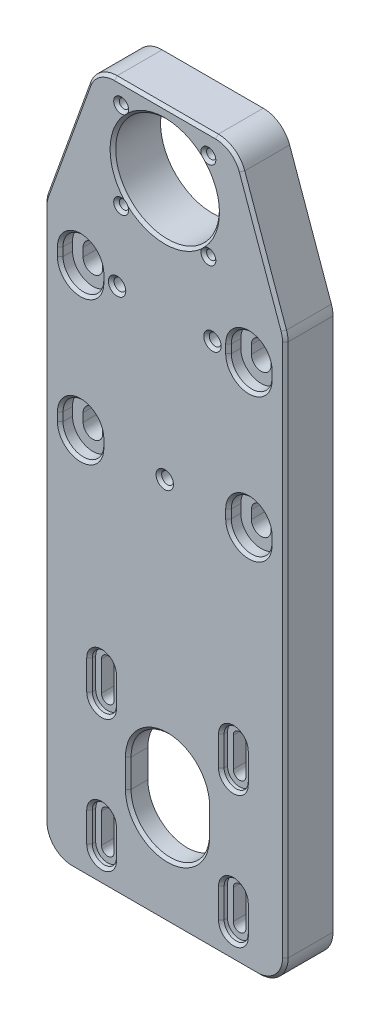
from build123d import *

# Parameters (mm, degrees)
SKETCH1_R                                = 18.5
SKETCH1_W                                = 86
SKETCH1_H                                = 77
SKETCH1_H_2                              = 125
BOSS_EXTRUDE1_DEPTH                      = 17
M4X0_7_TAPPED_HOLE1_D                    = 3.3
M4X0_7_TAPPED_HOLE1_DEPTH                = 20
M4X0_7_TAPPED_HOLE1_TIP                  = 0.991420021
CBORE_SLOT_FOR_M4_SBHCS3_DEPTH           = 17
CBORE_START                              = 14.8
CBORE_SLOT_FOR_M4_SBHCS3_2_DEPTH         = 2.2
CUT_EXTRUDE1_DEPTH                       = 138.03649149
CBORE_SLOT_FOR_M6_HEX_HEAD_BOLT1_DEPTH   = 17
CBORE_START_2                            = 12.62
CBORE_SLOT_FOR_M6_HEX_HEAD_BOLT1_2_DEPTH = 4.38
FILLET1_R                                = 10
CUT_EXTRUDE2_DEPTH                       = 10
SKETCH22_R                               = 2.1
CUT_EXTRUDE3_DEPTH                       = 138.03649149
CHAMFER1_SIZE                            = 1


# Read off the part's stored shape, not the designer's step: CBORE SLOT for M4 SBHCS3, CBORE SLOT for M6 Hex Head Bolt1
with BuildPart() as part:
    # Sketch1 → Boss-Extrude1 (new body)
    # profile 1 of 3: a face of its own
    with BuildSketch(Plane.XY):
        Polygon((14.773286703, 129), (-14.773286703, 129), (-24.97132573, 129), (-43, 79), (43, 79), (25.15845151, 129), (20.15845151, 129), align=None)
        with Locations((0, 106)):
            Circle(SKETCH1_R, mode=Mode.SUBTRACT)
    # profile 2 of 3: a face of its own
    with BuildSketch(Plane.XY):
        with Locations((0, 40.5)):
            Rectangle(SKETCH1_W, SKETCH1_H)
    # profile 3 of 3: a face of its own
    with BuildSketch(Plane.XY):
        with Locations((0, -60.5)):
            Rectangle(SKETCH1_W, SKETCH1_H_2)
    extrude(amount=BOSS_EXTRUDE1_DEPTH)

    # M4x0.7 Tapped Hole1
    with Locations(Plane(origin=(-15.556349182, 90.443650818, 17), x_dir=(1, 0, 0), z_dir=(0, 0, 1))):
        with Locations((0, 0), (0, 31.112698364), (31.112698364, 31.112698364), (31.112698364, 0)):
            Hole(M4X0_7_TAPPED_HOLE1_D / 2, depth=M4X0_7_TAPPED_HOLE1_DEPTH)
            with Locations((0, 0, -(M4X0_7_TAPPED_HOLE1_DEPTH + M4X0_7_TAPPED_HOLE1_TIP / 2))):  # 118° drill point
                Cone(0, M4X0_7_TAPPED_HOLE1_D / 2, M4X0_7_TAPPED_HOLE1_TIP, mode=Mode.SUBTRACT)

    # CBORE SLOT for M4 SBHCS3 outline → CBORE SLOT for M4 SBHCS3 (cut)
    with BuildSketch(Plane.XY):
        with BuildLine():
            ThreePointArc((-20.274967442, -102.200025), (-22.524967442, -99.950025), (-24.774967442, -102.200025))
            Line((-24.774967442, -102.200025), (-24.774967442, -112.700025))
            ThreePointArc((-24.774967442, -112.700025), (-22.524967442, -114.950025), (-20.274967442, -112.700025))
            Line((-20.274967442, -112.700025), (-20.274967442, -102.200025))
        make_face()
        with BuildLine():
            ThreePointArc((-20.274967442, -55.200025), (-22.524967442, -52.950025), (-24.774967442, -55.200025))
            Line((-24.774967442, -55.200025), (-24.774967442, -65.700025))
            ThreePointArc((-24.774967442, -65.700025), (-22.524967442, -67.950025), (-20.274967442, -65.700025))
            Line((-20.274967442, -65.700025), (-20.274967442, -55.200025))
        make_face()
        with BuildLine():
            Line((26.725032558, -112.700025), (26.725032558, -102.200025))
            ThreePointArc((26.725032558, -102.200025), (24.475032558, -99.950025), (22.225032558, -102.200025))
            Line((22.225032558, -102.200025), (22.225032558, -112.700025))
            ThreePointArc((22.225032558, -112.700025), (24.475032558, -114.950025), (26.725032558, -112.700025))
        make_face()
        with BuildLine():
            ThreePointArc((22.225032558, -65.700025), (24.475032558, -67.950025), (26.725032558, -65.700025))
            Line((26.725032558, -65.700025), (26.725032558, -55.200025))
            ThreePointArc((26.725032558, -55.200025), (24.475032558, -52.950025), (22.225032558, -55.200025))
            Line((22.225032558, -55.200025), (22.225032558, -65.700025))
        make_face()
    extrude(amount=CBORE_SLOT_FOR_M4_SBHCS3_DEPTH, mode=Mode.SUBTRACT)

    # CBORE SLOT for M4 SBHCS3 2 outline → CBORE SLOT for M4 SBHCS3 2 (cut)
    # profile 1 of 4: a face of its own
    with BuildSketch(Plane.XY.offset(CBORE_START)):
        with BuildLine():
            Line((-18.224967442, -112.700025), (-18.224967442, -102.200025))
            ThreePointArc((-18.224967442, -102.200025), (-22.524967442, -97.900025), (-26.824967442, -102.200025))
            Line((-26.824967442, -102.200025), (-26.824967442, -112.700025))
            ThreePointArc((-26.824967442, -112.700025), (-22.524967442, -117.000025), (-18.224967442, -112.700025))
        make_face()
        with BuildLine():
            Line((-24.774967442, -112.700025), (-24.774967442, -102.200025))
            ThreePointArc((-24.774967442, -102.200025), (-22.524967442, -99.950025), (-20.274967442, -102.200025))
            Line((-20.274967442, -102.200025), (-20.274967442, -112.700025))
            ThreePointArc((-20.274967442, -112.700025), (-22.524967442, -114.950025), (-24.774967442, -112.700025))
        make_face(mode=Mode.SUBTRACT)
    # profile 2 of 4: a face of its own
    with BuildSketch(Plane.XY.offset(CBORE_START)):
        with BuildLine():
            ThreePointArc((-18.224967442, -55.200025), (-22.524967442, -50.900025), (-26.824967442, -55.200025))
            Line((-26.824967442, -55.200025), (-26.824967442, -65.700025))
            ThreePointArc((-26.824967442, -65.700025), (-22.524967442, -70.000025), (-18.224967442, -65.700025))
            Line((-18.224967442, -65.700025), (-18.224967442, -55.200025))
        make_face()
        with BuildLine():
            Line((-24.774967442, -65.700025), (-24.774967442, -55.200025))
            ThreePointArc((-24.774967442, -55.200025), (-22.524967442, -52.950025), (-20.274967442, -55.200025))
            Line((-20.274967442, -55.200025), (-20.274967442, -65.700025))
            ThreePointArc((-20.274967442, -65.700025), (-22.524967442, -67.950025), (-24.774967442, -65.700025))
        make_face(mode=Mode.SUBTRACT)
    # profile 3 of 4: a face of its own
    with BuildSketch(Plane.XY.offset(CBORE_START)):
        with BuildLine():
            Line((28.775032558, -112.700025), (28.775032558, -102.200025))
            ThreePointArc((28.775032558, -102.200025), (24.475032558, -97.900025), (20.175032558, -102.200025))
            Line((20.175032558, -102.200025), (20.175032558, -112.700025))
            ThreePointArc((20.175032558, -112.700025), (24.475032558, -117.000025), (28.775032558, -112.700025))
        make_face()
        with BuildLine():
            ThreePointArc((22.225032558, -102.200025), (24.475032558, -99.950025), (26.725032558, -102.200025))
            Line((26.725032558, -102.200025), (26.725032558, -112.700025))
            ThreePointArc((26.725032558, -112.700025), (24.475032558, -114.950025), (22.225032558, -112.700025))
            Line((22.225032558, -112.700025), (22.225032558, -102.200025))
        make_face(mode=Mode.SUBTRACT)
    # profile 4 of 4: a face of its own
    with BuildSketch(Plane.XY.offset(CBORE_START)):
        with BuildLine():
            ThreePointArc((28.775032558, -55.200025), (24.475032558, -50.900025), (20.175032558, -55.200025))
            Line((20.175032558, -55.200025), (20.175032558, -65.700025))
            ThreePointArc((20.175032558, -65.700025), (24.475032558, -70.000025), (28.775032558, -65.700025))
            Line((28.775032558, -65.700025), (28.775032558, -55.200025))
        make_face()
        with BuildLine():
            Line((26.725032558, -55.200025), (26.725032558, -65.700025))
            ThreePointArc((26.725032558, -65.700025), (24.475032558, -67.950025), (22.225032558, -65.700025))
            Line((22.225032558, -65.700025), (22.225032558, -55.200025))
            ThreePointArc((22.225032558, -55.200025), (24.475032558, -52.950025), (26.725032558, -55.200025))
        make_face(mode=Mode.SUBTRACT)
    extrude(amount=CBORE_SLOT_FOR_M4_SBHCS3_2_DEPTH, mode=Mode.SUBTRACT)

    # Sketch13 → Cut-Extrude1 (cut, through all)
    with BuildSketch(Plane.XY.offset(17)):
        with BuildLine():
            Line((14.975032558, -78.950025), (14.975032558, -88.950025))
            ThreePointArc((14.975032558, -88.950025), (0.975032558, -102.950025), (-13.024967442, -88.950025))
            Line((-13.024967442, -88.950025), (-13.024967442, -78.950025))
            ThreePointArc((-13.024967442, -78.950025), (0.975032558, -64.950025), (14.975032558, -78.950025))
        make_face()
    extrude(amount=-CUT_EXTRUDE1_DEPTH, mode=Mode.SUBTRACT)

    # CBORE SLOT for M6 Hex Head Bolt1 outline → CBORE SLOT for M6 Hex Head Bolt1 (cut)
    with BuildSketch(Plane.XY):
        with BuildLine():
            Line((26.5, 15.5), (26.5, 12.5))
            ThreePointArc((26.5, 12.5), (30, 9), (33.5, 12.5))
            Line((33.5, 12.5), (33.5, 15.5))
            ThreePointArc((33.5, 15.5), (30, 19), (26.5, 15.5))
        make_face()
        with BuildLine():
            ThreePointArc((26.5, 63.5), (30, 60), (33.5, 63.5))
            Line((33.5, 63.5), (33.5, 66.5))
            ThreePointArc((33.5, 66.5), (30, 70), (26.5, 66.5))
            Line((26.5, 66.5), (26.5, 63.5))
        make_face()
        with BuildLine():
            ThreePointArc((-33.5, 12.5), (-30, 9), (-26.5, 12.5))
            Line((-26.5, 12.5), (-26.5, 15.5))
            ThreePointArc((-26.5, 15.5), (-30, 19), (-33.5, 15.5))
            Line((-33.5, 15.5), (-33.5, 12.5))
        make_face()
        with BuildLine():
            ThreePointArc((-33.5, 63.5), (-30, 60), (-26.5, 63.5))
            Line((-26.5, 63.5), (-26.5, 66.5))
            ThreePointArc((-26.5, 66.5), (-30, 70), (-33.5, 66.5))
            Line((-33.5, 66.5), (-33.5, 63.5))
        make_face()
    extrude(amount=CBORE_SLOT_FOR_M6_HEX_HEAD_BOLT1_DEPTH, mode=Mode.SUBTRACT)

    # CBORE SLOT for M6 Hex Head Bolt1 2 outli → CBORE SLOT for M6 Hex Head Bolt1 2 (cut)
    # profile 1 of 4: a face of its own
    with BuildSketch(Plane.XY.offset(CBORE_START_2)):
        with BuildLine():
            Line((37.275, 12.5), (37.275, 15.5))
            ThreePointArc((37.275, 15.5), (30, 22.775), (22.725, 15.5))
            Line((22.725, 15.5), (22.725, 12.5))
            ThreePointArc((22.725, 12.5), (30, 5.225), (37.275, 12.5))
        make_face()
        with BuildLine():
            ThreePointArc((33.5, 12.5), (30, 9), (26.5, 12.5))
            Line((26.5, 12.5), (26.5, 15.5))
            ThreePointArc((26.5, 15.5), (30, 19), (33.5, 15.5))
            Line((33.5, 15.5), (33.5, 12.5))
        make_face(mode=Mode.SUBTRACT)
    # profile 2 of 4: a face of its own
    with BuildSketch(Plane.XY.offset(CBORE_START_2)):
        with BuildLine():
            ThreePointArc((37.275, 66.5), (30, 73.775), (22.725, 66.5))
            Line((22.725, 66.5), (22.725, 63.5))
            ThreePointArc((22.725, 63.5), (30, 56.225), (37.275, 63.5))
            Line((37.275, 63.5), (37.275, 66.5))
        make_face()
        with BuildLine():
            Line((33.5, 66.5), (33.5, 63.5))
            ThreePointArc((33.5, 63.5), (30, 60), (26.5, 63.5))
            Line((26.5, 63.5), (26.5, 66.5))
            ThreePointArc((26.5, 66.5), (30, 70), (33.5, 66.5))
        make_face(mode=Mode.SUBTRACT)
    # profile 3 of 4: a face of its own
    with BuildSketch(Plane.XY.offset(CBORE_START_2)):
        with BuildLine():
            Line((-22.725, 12.5), (-22.725, 15.5))
            ThreePointArc((-22.725, 15.5), (-30, 22.775), (-37.275, 15.5))
            Line((-37.275, 15.5), (-37.275, 12.5))
            ThreePointArc((-37.275, 12.5), (-30, 5.225), (-22.725, 12.5))
        make_face()
        with BuildLine():
            Line((-26.5, 15.5), (-26.5, 12.5))
            ThreePointArc((-26.5, 12.5), (-30, 9), (-33.5, 12.5))
            Line((-33.5, 12.5), (-33.5, 15.5))
            ThreePointArc((-33.5, 15.5), (-30, 19), (-26.5, 15.5))
        make_face(mode=Mode.SUBTRACT)
    # profile 4 of 4: a face of its own
    with BuildSketch(Plane.XY.offset(CBORE_START_2)):
        with BuildLine():
            ThreePointArc((-22.725, 66.5), (-30, 73.775), (-37.275, 66.5))
            Line((-37.275, 66.5), (-37.275, 63.5))
            ThreePointArc((-37.275, 63.5), (-30, 56.225), (-22.725, 63.5))
            Line((-22.725, 63.5), (-22.725, 66.5))
        make_face()
        with BuildLine():
            Line((-26.5, 66.5), (-26.5, 63.5))
            ThreePointArc((-26.5, 63.5), (-30, 60), (-33.5, 63.5))
            Line((-33.5, 63.5), (-33.5, 66.5))
            ThreePointArc((-33.5, 66.5), (-30, 70), (-26.5, 66.5))
        make_face(mode=Mode.SUBTRACT)
    extrude(amount=CBORE_SLOT_FOR_M6_HEX_HEAD_BOLT1_2_DEPTH, mode=Mode.SUBTRACT)

    # Fillet1
    fillet1_edges = [part.edges().sort_by_distance(p)[0] for p in [
        (-43, 79, 8.5),
        (-24.97132573, 129, 8.5),
        (25.15845151, 129, 8.5),
        (43, 79, 8.5),
        (43, -123, 8.5),
        (-43, -123, 8.5),
    ]]
    fillet(fillet1_edges, radius=FILLET1_R)

    # Sketch21 → Cut-Extrude2 (cut)
    with BuildSketch(Plane(origin=(0, 0, 0), x_dir=(-1, 0, 0), z_dir=(0, 0, -1))):
        with BuildLine():
            Line((-31.475032558, -51.050025), (-31.475032558, -116.850025))
            ThreePointArc((-31.475032558, -116.850025), (-30.859956799, -118.33494924), (-29.375032558, -118.950025))
            Line((-29.375032558, -118.950025), (27.424967442, -118.950025))
            ThreePointArc((27.424967442, -118.950025), (28.909891682, -118.33494924), (29.524967442, -116.850025))
            Line((29.524967442, -116.850025), (29.524967442, -51.050025))
            ThreePointArc((29.524967442, -51.050025), (28.909891682, -49.56510076), (27.424967442, -48.950025))
            Line((27.424967442, -48.950025), (-29.375032558, -48.950025))
            ThreePointArc((-29.375032558, -48.950025), (-30.859956799, -49.56510076), (-31.475032558, -51.050025))
        make_face()
        with BuildLine():
            ThreePointArc((-22.225032558, -112.700025), (-24.475032558, -114.950025), (-26.725032558, -112.700025))
            Line((-26.725032558, -112.700025), (-26.725032558, -102.200025))
            ThreePointArc((-26.725032558, -102.200025), (-24.475032558, -99.950025), (-22.225032558, -102.200025))
            Line((-22.225032558, -102.200025), (-22.225032558, -112.700025))
        make_face(mode=Mode.SUBTRACT)
        with BuildLine():
            Line((-22.225032558, -55.200025), (-22.225032558, -65.700025))
            ThreePointArc((-22.225032558, -65.700025), (-24.475032558, -67.950025), (-26.725032558, -65.700025))
            Line((-26.725032558, -65.700025), (-26.725032558, -55.200025))
            ThreePointArc((-26.725032558, -55.200025), (-24.475032558, -52.950025), (-22.225032558, -55.200025))
        make_face(mode=Mode.SUBTRACT)
        with BuildLine():
            Line((-14.975032558, -88.950025), (-14.975032558, -78.950025))
            ThreePointArc((-14.975032558, -78.950025), (-0.975032558, -64.950025), (13.024967442, -78.950025))
            Line((13.024967442, -78.950025), (13.024967442, -88.950025))
            ThreePointArc((13.024967442, -88.950025), (-0.975032558, -102.950025), (-14.975032558, -88.950025))
        make_face(mode=Mode.SUBTRACT)
        with BuildLine():
            Line((20.274967442, -112.700025), (20.274967442, -102.200025))
            ThreePointArc((20.274967442, -102.200025), (22.524967442, -99.950025), (24.774967442, -102.200025))
            Line((24.774967442, -102.200025), (24.774967442, -112.700025))
            ThreePointArc((24.774967442, -112.700025), (22.524967442, -114.950025), (20.274967442, -112.700025))
        make_face(mode=Mode.SUBTRACT)
        with BuildLine():
            Line((20.274967442, -65.700025), (20.274967442, -55.200025))
            ThreePointArc((20.274967442, -55.200025), (22.524967442, -52.950025), (24.774967442, -55.200025))
            Line((24.774967442, -55.200025), (24.774967442, -65.700025))
            ThreePointArc((24.774967442, -65.700025), (22.524967442, -67.950025), (20.274967442, -65.700025))
        make_face(mode=Mode.SUBTRACT)
    extrude(amount=-CUT_EXTRUDE2_DEPTH, mode=Mode.SUBTRACT)

    # Sketch22 → Cut-Extrude3 (cut, through all)
    with BuildSketch(Plane.XY.offset(17)):
        with Locations((0, 13.760699385)):
            Circle(SKETCH22_R)
        with Locations((-17, 65)):
            Circle(SKETCH22_R)
        with Locations((17, 65)):
            Circle(SKETCH22_R)
    extrude(amount=-CUT_EXTRUDE3_DEPTH, mode=Mode.SUBTRACT)

    # Chamfer1
    # the kernel refuses this chamfer: 1 mm, written as the material it takes off along each edge
    with BuildSketch(Plane(origin=(28.775032558, -65.700025, 17), x_dir=(0.9996219169112968, 0, 0.027495876610585647), z_dir=(0, 1, 0)), Plane(origin=(20.175032558, -55.200025, 17), x_dir=(-0.9996219169112968, 0, 0.027495876610585647), z_dir=(0, -1, 0)), Plane(origin=(-18.224967442, -65.700025, 17), x_dir=(0.9996219169112968, 0, 0.027495876610585647), z_dir=(0, 1, 0)), Plane(origin=(-26.824967442, -55.200025, 17), x_dir=(-0.9996219169112968, 0, 0.027495876610585647), z_dir=(0, -1, 0)), Plane(origin=(-18.224967442, -112.700025, 17), x_dir=(0.9996219169112968, 0, 0.027495876610585647), z_dir=(0, 1, 0)), Plane(origin=(-26.824967442, -102.200025, 17), x_dir=(-0.9996219169112968, 0, 0.027495876610585647), z_dir=(0, -1, 0)), Plane(origin=(28.775032558, -112.700025, 17), x_dir=(0.9996219169112968, 0, 0.027495876610585647), z_dir=(0, 1, 0)), Plane(origin=(20.175032558, -102.200025, 17), x_dir=(-0.9996219169112968, 0, 0.027495876610585647), z_dir=(0, -1, 0))) as chamfer1_piece_1:
        Polygon((CHAMFER1_SIZE * 0.999621916911, CHAMFER1_SIZE * 0.0274958766106), (-CHAMFER1_SIZE * 0.0274958766106, CHAMFER1_SIZE * 0.999621916911), (0, 0), align=None)
    extrude(amount=10.5, mode=Mode.SUBTRACT)
    with BuildSketch(Plane(origin=(24.475032558, -55.200025, 17), x_dir=(1, 0, 0), z_dir=(0, -1, 0))) as chamfer1_piece_2:
        Polygon((4.3 + CHAMFER1_SIZE, 0), (4.3, -CHAMFER1_SIZE), (4.3, 0), align=None)
    revolve(axis=Axis((24.475032558, -55.200025, 17), (0, 0, 1)), revolution_arc=180, mode=Mode.SUBTRACT)
    with BuildSketch(Plane(origin=(24.475032558, -65.700025, 17), x_dir=(-1, 0, 0), z_dir=(0, 1, 0))) as chamfer1_piece_3:
        Polygon((4.3 + CHAMFER1_SIZE, 0), (4.3, -CHAMFER1_SIZE), (4.3, 0), align=None)
    revolve(axis=Axis((24.475032558, -65.700025, 17), (0, 0, 1)), revolution_arc=180, mode=Mode.SUBTRACT)
    with BuildSketch(Plane(origin=(-22.524967442, -55.200025, 17), x_dir=(1, 0, 0), z_dir=(0, -1, 0))) as chamfer1_piece_4:
        Polygon((4.3 + CHAMFER1_SIZE, 0), (4.3, -CHAMFER1_SIZE), (4.3, 0), align=None)
    revolve(axis=Axis((-22.524967442, -55.200025, 17), (0, 0, 1)), revolution_arc=180, mode=Mode.SUBTRACT)
    with BuildSketch(Plane(origin=(-22.524967442, -65.700025, 17), x_dir=(-1, 0, 0), z_dir=(0, 1, 0))) as chamfer1_piece_5:
        Polygon((4.3 + CHAMFER1_SIZE, 0), (4.3, -CHAMFER1_SIZE), (4.3, 0), align=None)
    revolve(axis=Axis((-22.524967442, -65.700025, 17), (0, 0, 1)), revolution_arc=180, mode=Mode.SUBTRACT)
    with BuildSketch(Plane(origin=(0.975032558, -78.950025, 17), x_dir=(-1, 0, 0), z_dir=(0, -1, 0))) as chamfer1_piece_6:
        Polygon((14 + CHAMFER1_SIZE, 0), (14, CHAMFER1_SIZE), (14, 0), align=None)
    revolve(axis=Axis((0.975032558, -78.950025, 17), (0, 0, -1)), revolution_arc=180, mode=Mode.SUBTRACT)
    with BuildSketch(Plane(origin=(-13.024967442, -88.950025, 17), x_dir=(-0.9996219169112968, 0, 0.027495876610585647), z_dir=(0, 1, 0)), Plane(origin=(14.975032558, -78.950025, 17), x_dir=(0.9996219169112968, 0, 0.027495876610585647), z_dir=(0, -1, 0))) as chamfer1_piece_7:
        Polygon((CHAMFER1_SIZE * 0.999621916911, -CHAMFER1_SIZE * 0.0274958766106), (-CHAMFER1_SIZE * 0.0274958766106, -CHAMFER1_SIZE * 0.999621916911), (0, 0), align=None)
    extrude(amount=10, mode=Mode.SUBTRACT)
    with BuildSketch(Plane(origin=(0.975032558, -88.950025, 17), x_dir=(1, 0, 0), z_dir=(0, 1, 0))) as chamfer1_piece_8:
        Polygon((14 + CHAMFER1_SIZE, 0), (14, CHAMFER1_SIZE), (14, 0), align=None)
    revolve(axis=Axis((0.975032558, -88.950025, 17), (0, 0, -1)), revolution_arc=180, mode=Mode.SUBTRACT)
    with BuildSketch(Plane(origin=(37.275, 12.5, 17), x_dir=(0.9996219169112968, 0, 0.02749587661058555), z_dir=(0, 1, 0)), Plane(origin=(22.725, 15.5, 17), x_dir=(-0.9996219169112968, 0, 0.027495876610585647), z_dir=(0, -1, 0)), Plane(origin=(-22.725, 12.5, 17), x_dir=(0.9996219169112968, 0, 0.027495876610585647), z_dir=(0, 1, 0)), Plane(origin=(-37.275, 15.5, 17), x_dir=(-0.9996219169112968, 0, 0.02749587661058555), z_dir=(0, -1, 0)), Plane(origin=(-22.725, 63.5, 17), x_dir=(0.9996219169112968, 0, 0.027495876610585647), z_dir=(0, 1, 0)), Plane(origin=(-37.275, 66.5, 17), x_dir=(-0.9996219169112968, 0, 0.02749587661058555), z_dir=(0, -1, 0)), Plane(origin=(37.275, 63.5, 17), x_dir=(0.9996219169112968, 0, 0.02749587661058555), z_dir=(0, 1, 0)), Plane(origin=(22.725, 66.5, 17), x_dir=(-0.9996219169112968, 0, 0.027495876610585647), z_dir=(0, -1, 0))) as chamfer1_piece_9:
        Polygon((CHAMFER1_SIZE * 0.999621916911, CHAMFER1_SIZE * 0.0274958766106), (-CHAMFER1_SIZE * 0.0274958766106, CHAMFER1_SIZE * 0.999621916911), (0, 0), align=None)
    extrude(amount=3, mode=Mode.SUBTRACT)
    with BuildSketch(Plane(origin=(30, 15.5, 17), x_dir=(1, 0, 0), z_dir=(0, -1, 0))) as chamfer1_piece_10:
        Polygon((7.275 + CHAMFER1_SIZE, 0), (7.275, -CHAMFER1_SIZE), (7.275, 0), align=None)
    revolve(axis=Axis((30, 15.5, 17), (0, 0, 1)), revolution_arc=180, mode=Mode.SUBTRACT)
    with BuildSketch(Plane(origin=(30, 12.5, 17), x_dir=(-1, 0, 0), z_dir=(0, 1, 0))) as chamfer1_piece_11:
        Polygon((7.275 + CHAMFER1_SIZE, 0), (7.275, -CHAMFER1_SIZE), (7.275, 0), align=None)
    revolve(axis=Axis((30, 12.5, 17), (0, 0, 1)), revolution_arc=180, mode=Mode.SUBTRACT)
    with BuildSketch(Plane(origin=(-30, 15.5, 17), x_dir=(1, 0, 0), z_dir=(0, -1, 0))) as chamfer1_piece_12:
        Polygon((7.275 + CHAMFER1_SIZE, 0), (7.275, -CHAMFER1_SIZE), (7.275, 0), align=None)
    revolve(axis=Axis((-30, 15.5, 17), (0, 0, 1)), revolution_arc=180, mode=Mode.SUBTRACT)
    with BuildSketch(Plane(origin=(-30, 12.5, 17), x_dir=(-1, 0, 0), z_dir=(0, 1, 0))) as chamfer1_piece_13:
        Polygon((7.275 + CHAMFER1_SIZE, 0), (7.275, -CHAMFER1_SIZE), (7.275, 0), align=None)
    revolve(axis=Axis((-30, 12.5, 17), (0, 0, 1)), revolution_arc=180, mode=Mode.SUBTRACT)
    with BuildSketch(Plane(origin=(-30, 66.5, 17), x_dir=(1, 0, 0), z_dir=(0, -1, 0))) as chamfer1_piece_14:
        Polygon((7.275 + CHAMFER1_SIZE, 0), (7.275, -CHAMFER1_SIZE), (7.275, 0), align=None)
    revolve(axis=Axis((-30, 66.5, 17), (0, 0, 1)), revolution_arc=180, mode=Mode.SUBTRACT)
    with BuildSketch(Plane(origin=(-30, 63.5, 17), x_dir=(-1, 0, 0), z_dir=(0, 1, 0))) as chamfer1_piece_15:
        Polygon((7.275 + CHAMFER1_SIZE, 0), (7.275, -CHAMFER1_SIZE), (7.275, 0), align=None)
    revolve(axis=Axis((-30, 63.5, 17), (0, 0, 1)), revolution_arc=180, mode=Mode.SUBTRACT)
    with BuildSketch(Plane(origin=(30, 66.5, 17), x_dir=(1, 0, 0), z_dir=(0, -1, 0))) as chamfer1_piece_16:
        Polygon((7.275 + CHAMFER1_SIZE, 0), (7.275, -CHAMFER1_SIZE), (7.275, 0), align=None)
    revolve(axis=Axis((30, 66.5, 17), (0, 0, 1)), revolution_arc=180, mode=Mode.SUBTRACT)
    with BuildSketch(Plane(origin=(30, 63.5, 17), x_dir=(-1, 0, 0), z_dir=(0, 1, 0))) as chamfer1_piece_17:
        Polygon((7.275 + CHAMFER1_SIZE, 0), (7.275, -CHAMFER1_SIZE), (7.275, 0), align=None)
    revolve(axis=Axis((30, 63.5, 17), (0, 0, 1)), revolution_arc=180, mode=Mode.SUBTRACT)
    with BuildSketch(Plane(origin=(42.418349174, 80.630045807, 17), x_dir=(-0.9414788255482561, -0.33594880236978336, 0.027495876610585532), z_dir=(-0.3360758669716067, 0.9418349174028764, 0))) as chamfer1_piece_18:
        Polygon((CHAMFER1_SIZE * 0.999621916911, -CHAMFER1_SIZE * 0.0274958766106), (-CHAMFER1_SIZE * 0.0274958766106, -CHAMFER1_SIZE * 0.999621916911), (0, 0), align=None)
    extrude(amount=44.307884633, mode=Mode.SUBTRACT)
    with BuildSketch(Plane(origin=(15.556349182, 90.443650818, 17), x_dir=(-1, 0, 0), z_dir=(0, -1, 0))) as chamfer1_piece_19:
        Polygon((1.65 + CHAMFER1_SIZE, 0), (1.65, CHAMFER1_SIZE), (1.65, 0), align=None)
    revolve(axis=Axis((15.556349182, 90.443650818, 17), (0, 0, -1)), mode=Mode.SUBTRACT)
    with BuildSketch(Plane(origin=(43, -113, 17), x_dir=(-0.9996219169112968, 0, 0.02749587661058555), z_dir=(0, 1, 0))) as chamfer1_piece_20:
        Polygon((CHAMFER1_SIZE * 0.999621916911, -CHAMFER1_SIZE * 0.0274958766106), (-CHAMFER1_SIZE * 0.0274958766106, -CHAMFER1_SIZE * 0.999621916911), (0, 0), align=None)
    extrude(amount=190.269287137, mode=Mode.SUBTRACT)
    with BuildSketch(Plane(origin=(-43, 77.25220626, 17), x_dir=(0.9996219169112968, 0, 0.02749587661058555), z_dir=(0, -1, 0))) as chamfer1_piece_21:
        Polygon((CHAMFER1_SIZE * 0.999621916911, -CHAMFER1_SIZE * 0.0274958766106), (-CHAMFER1_SIZE * 0.0274958766106, -CHAMFER1_SIZE * 0.999621916911), (0, 0), align=None)
    extrude(amount=190.25220626, mode=Mode.SUBTRACT)
    with BuildSketch(Plane(origin=(-33, -123, 17), x_dir=(0, 0.9996219169112968, 0.027495876610586122), z_dir=(1, 0, 0))) as chamfer1_piece_22:
        Polygon((CHAMFER1_SIZE * 0.999621916911, -CHAMFER1_SIZE * 0.0274958766106), (-CHAMFER1_SIZE * 0.0274958766106, -CHAMFER1_SIZE * 0.999621916911), (0, 0), align=None)
    extrude(amount=66, mode=Mode.SUBTRACT)
    with BuildSketch(Plane(origin=(-17.946852503, 129, 17), x_dir=(0, 0.0274958766105822, -0.999621916911297), z_dir=(1, 0, 0))) as chamfer1_piece_23:
        Polygon((CHAMFER1_SIZE * 0.999621916911, -CHAMFER1_SIZE * 0.0274958766106), (-CHAMFER1_SIZE * 0.0274958766106, -CHAMFER1_SIZE * 0.999621916911), (0, 0), align=None)
    extrude(amount=36.056041762, mode=Mode.SUBTRACT)
    with BuildSketch(Plane(origin=(-27.354006083, 122.391970154, 17), x_dir=(0.9403596894143853, -0.33906877074407227, 0.027495876610585616), z_dir=(-0.3391970153993334, -0.9407153579825219, 0))) as chamfer1_piece_24:
        Polygon((CHAMFER1_SIZE * 0.999621916911, -CHAMFER1_SIZE * 0.0274958766106), (-CHAMFER1_SIZE * 0.0274958766106, -CHAMFER1_SIZE * 0.999621916911), (0, 0), align=None)
    extrude(amount=44.378773436, mode=Mode.SUBTRACT)
    with BuildSketch(Plane(origin=(33, -113, 17), x_dir=(0, -1, 0), z_dir=(-1, 0, 0))) as chamfer1_piece_25:
        Polygon((10 - CHAMFER1_SIZE, 0), (10, -CHAMFER1_SIZE), (10, 0), align=None)
    revolve(axis=Axis((33, -113, 17), (0, 0, 1)), revolution_arc=90, mode=Mode.SUBTRACT)
    with BuildSketch(Plane(origin=(-33, -113, 17), x_dir=(-1, 0, 0), z_dir=(0, 1, 0))) as chamfer1_piece_26:
        Polygon((10 - CHAMFER1_SIZE, 0), (10, -CHAMFER1_SIZE), (10, 0), align=None)
    revolve(axis=Axis((-33, -113, 17), (0, 0, 1)), revolution_arc=90, mode=Mode.SUBTRACT)
    with BuildSketch(Plane(origin=(-33, 77.25220626, 17), x_dir=(-0.9407153579825221, 0.3391970153993328, 0), z_dir=(0.3391970153993328, 0.9407153579825221, 0))) as chamfer1_piece_27:
        Polygon((10 - CHAMFER1_SIZE, 0), (10, -CHAMFER1_SIZE), (10, 0), align=None)
    revolve(axis=Axis((-33, 77.25220626, 17), (0, 0, 1)), revolution_arc=19.827959469, mode=Mode.SUBTRACT)
    with BuildSketch(Plane(origin=(-17.946852503, 119, 17), x_dir=(0, 1, 0), z_dir=(1, 0, 0))) as chamfer1_piece_28:
        Polygon((10, -CHAMFER1_SIZE), (10 - CHAMFER1_SIZE, 0), (10, 0), align=None)
    revolve(axis=Axis((-17.946852503, 119, 17), (0, 0, 1)), revolution_arc=70.172040531, mode=Mode.SUBTRACT)
    with BuildSketch(Plane(origin=(18.109189258, 119, 17), x_dir=(0, 1, 0), z_dir=(-1, 0, 0))) as chamfer1_piece_29:
        Polygon((10, CHAMFER1_SIZE), (10 - CHAMFER1_SIZE, 0), (10, 0), align=None)
    revolve(axis=Axis((18.109189258, 119, 17), (0, 0, -1)), revolution_arc=70.362025862, mode=Mode.SUBTRACT)
    with BuildSketch(Plane(origin=(33, 77.269287137, 17), x_dir=(0.9418349174028765, 0.3360758669716064, 0), z_dir=(-0.3360758669716064, 0.9418349174028765, 0))) as chamfer1_piece_30:
        Polygon((10 - CHAMFER1_SIZE, 0), (10, CHAMFER1_SIZE), (10, 0), align=None)
    revolve(axis=Axis((33, 77.269287137, 17), (0, 0, -1)), revolution_arc=19.637974138, mode=Mode.SUBTRACT)
    with BuildSketch(Plane(origin=(15.556349182, 121.556349182, 17), x_dir=(-1, 0, 0), z_dir=(0, -1, 0))) as chamfer1_piece_31:
        Polygon((1.65 + CHAMFER1_SIZE, 0), (1.65, CHAMFER1_SIZE), (1.65, 0), align=None)
    revolve(axis=Axis((15.556349182, 121.556349182, 17), (0, 0, -1)), mode=Mode.SUBTRACT)
    with BuildSketch(Plane(origin=(0, 13.760699385, 17), x_dir=(1, 0, 0), z_dir=(0, -1, 0))) as chamfer1_piece_32:
        Polygon((2.1 + CHAMFER1_SIZE, 0), (2.1, -CHAMFER1_SIZE), (2.1, 0), align=None)
    revolve(axis=Axis((0, 13.760699385, 17), (0, 0, 1)), mode=Mode.SUBTRACT)
    with BuildSketch(Plane(origin=(-17, 65, 17), x_dir=(1, 0, 0), z_dir=(0, -1, 0))) as chamfer1_piece_33:
        Polygon((2.1 + CHAMFER1_SIZE, 0), (2.1, -CHAMFER1_SIZE), (2.1, 0), align=None)
    revolve(axis=Axis((-17, 65, 17), (0, 0, 1)), mode=Mode.SUBTRACT)
    with BuildSketch(Plane(origin=(17, 65, 17), x_dir=(1, 0, 0), z_dir=(0, -1, 0))) as chamfer1_piece_34:
        Polygon((2.1 + CHAMFER1_SIZE, 0), (2.1, -CHAMFER1_SIZE), (2.1, 0), align=None)
    revolve(axis=Axis((17, 65, 17), (0, 0, 1)), mode=Mode.SUBTRACT)
    with BuildSketch(Plane(origin=(-15.556349182, 121.556349182, 17), x_dir=(-1, 0, 0), z_dir=(0, -1, 0))) as chamfer1_piece_35:
        Polygon((1.65 + CHAMFER1_SIZE, 0), (1.65, CHAMFER1_SIZE), (1.65, 0), align=None)
    revolve(axis=Axis((-15.556349182, 121.556349182, 17), (0, 0, -1)), mode=Mode.SUBTRACT)
    with BuildSketch(Plane(origin=(-15.556349182, 90.443650818, 17), x_dir=(-1, 0, 0), z_dir=(0, -1, 0))) as chamfer1_piece_36:
        Polygon((1.65 + CHAMFER1_SIZE, 0), (1.65, CHAMFER1_SIZE), (1.65, 0), align=None)
    revolve(axis=Axis((-15.556349182, 90.443650818, 17), (0, 0, -1)), mode=Mode.SUBTRACT)
    with BuildSketch(Plane(origin=(-22.524967442, -102.200025, 17), x_dir=(1, 0, 0), z_dir=(0, -1, 0))) as chamfer1_piece_37:
        Polygon((4.3 + CHAMFER1_SIZE, 0), (4.3, -CHAMFER1_SIZE), (4.3, 0), align=None)
    revolve(axis=Axis((-22.524967442, -102.200025, 17), (0, 0, 1)), revolution_arc=180, mode=Mode.SUBTRACT)
    with BuildSketch(Plane(origin=(-22.524967442, -112.700025, 17), x_dir=(-1, 0, 0), z_dir=(0, 1, 0))) as chamfer1_piece_38:
        Polygon((4.3 + CHAMFER1_SIZE, 0), (4.3, -CHAMFER1_SIZE), (4.3, 0), align=None)
    revolve(axis=Axis((-22.524967442, -112.700025, 17), (0, 0, 1)), revolution_arc=180, mode=Mode.SUBTRACT)
    with BuildSketch(Plane(origin=(0, 106, 17), x_dir=(1, 0, 0), z_dir=(0, -1, 0))) as chamfer1_piece_39:
        Polygon((18.5 + CHAMFER1_SIZE, 0), (18.5, -CHAMFER1_SIZE), (18.5, 0), align=None)
    revolve(axis=Axis((0, 106, 17), (0, 0, 1)), mode=Mode.SUBTRACT)
    with BuildSketch(Plane(origin=(24.475032558, -102.200025, 17), x_dir=(1, 0, 0), z_dir=(0, -1, 0))) as chamfer1_piece_40:
        Polygon((4.3 + CHAMFER1_SIZE, 0), (4.3, -CHAMFER1_SIZE), (4.3, 0), align=None)
    revolve(axis=Axis((24.475032558, -102.200025, 17), (0, 0, 1)), revolution_arc=180, mode=Mode.SUBTRACT)
    with BuildSketch(Plane(origin=(24.475032558, -112.700025, 17), x_dir=(-1, 0, 0), z_dir=(0, 1, 0))) as chamfer1_piece_41:
        Polygon((4.3 + CHAMFER1_SIZE, 0), (4.3, -CHAMFER1_SIZE), (4.3, 0), align=None)
    revolve(axis=Axis((24.475032558, -112.700025, 17), (0, 0, 1)), revolution_arc=180, mode=Mode.SUBTRACT)


solid = part.part
